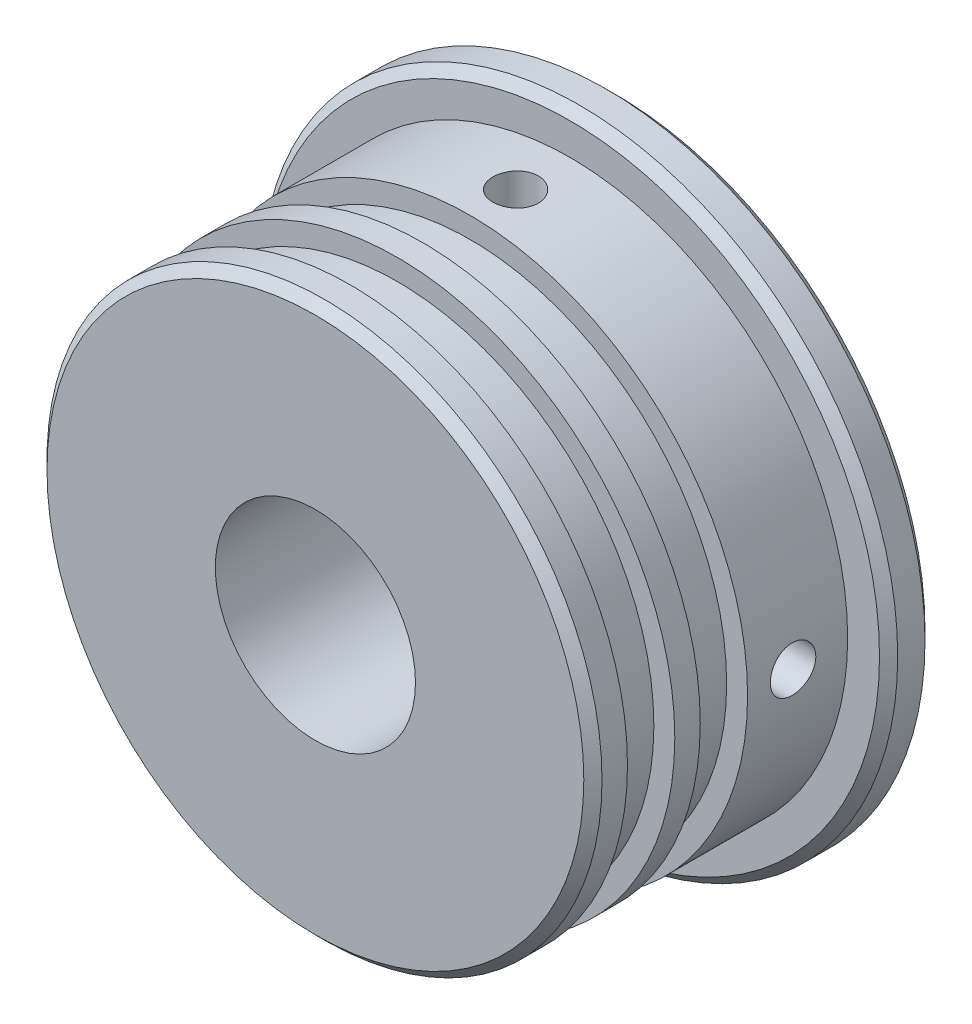
from build123d import *

# Parameters (mm, degrees)
SKETCH_1_R               = 17.5
SKETCH_1_R_2             = 5.5
EXTRUDE_1_DEPTH          = 2.5
EXTRUDE_START            = 14
SKETCH_1_3_R             = 15.25
SKETCH_1_3_R_2           = 5.5
EXTRUDE_2_DEPTH          = 14
CUT_EXTRUDE_START        = 8.1
SKETCH_1_4_R             = 15.25
SKETCH_1_4_R_2           = 14.1
CUT_EXTRUDE_1_DEPTH      = 2.6
CUT_EXTRUDE_START_2      = 12.1
SKETCH_1_5_R             = 15.25
SKETCH_1_5_R_2           = 14.1
CUT_EXTRUDE_2_DEPTH      = 2.6
CHAMFER_1_SIZE           = 0.5
SKETCH_2_R               = 6
CUT_EXTRUDE_3_DEPTH      = 2.5
CUT_EXTRUDE_START_3      = 10
SKETCH_3_R               = 1.25
CUT_EXTRUDE_4_DEPTH      = 10
PATTERN_CIRCULAR_1_COUNT = 4


with BuildPart() as part:
    # Эскиз1 → Бобышка-Вытянуть1 (new body)
    with BuildSketch(Plane.XY):
        Circle(SKETCH_1_R)
        Circle(SKETCH_1_R_2, mode=Mode.SUBTRACT)
    extrude(amount=-EXTRUDE_1_DEPTH)

    # Эскиз1<3> → Бобышка-Вытянуть2 (add)
    with BuildSketch(Plane.XY.offset(EXTRUDE_START)):
        Circle(SKETCH_1_3_R)
        Circle(SKETCH_1_3_R_2, mode=Mode.SUBTRACT)
    extrude(amount=-EXTRUDE_2_DEPTH)

    # Эскиз1<4> → Вырез-Вытянуть1 (cut)
    with BuildSketch(Plane.XY.offset(CUT_EXTRUDE_START)):
        Circle(SKETCH_1_4_R)
        Circle(SKETCH_1_4_R_2, mode=Mode.SUBTRACT)
    extrude(amount=-CUT_EXTRUDE_1_DEPTH, mode=Mode.SUBTRACT)

    # Эскиз1<5> → Вырез-Вытянуть2 (cut)
    with BuildSketch(Plane.XY.offset(CUT_EXTRUDE_START_2)):
        Circle(SKETCH_1_5_R)
        Circle(SKETCH_1_5_R_2, mode=Mode.SUBTRACT)
    extrude(amount=-CUT_EXTRUDE_2_DEPTH, mode=Mode.SUBTRACT)

    # Фаска1
    chamfer_1_edges = [part.edges().sort_by_distance(p)[0] for p in [
        (-15.25, 0, 14),
        (-17.5, 0, 0),
        (-17.5, 0, -2.5),
    ]]
    chamfer(chamfer_1_edges, length=CHAMFER_1_SIZE)

    # Эскиз2 → Вырез-Вытянуть3 (cut)
    with BuildSketch(Plane(origin=(0, 0, -2.5), x_dir=(-1, 0, 0), z_dir=(0, 0, -1))):
        Circle(SKETCH_2_R)
    extrude(amount=-CUT_EXTRUDE_3_DEPTH, mode=Mode.SUBTRACT)

    # Эскиз3 → Вырез-Вытянуть4 (cut)
    with BuildSketch(Plane(origin=(0, 0, 0), x_dir=(1, 0, 0), z_dir=(0, 1, 0)).offset(CUT_EXTRUDE_START_3)):
        with Locations((0, -3)):
            Circle(SKETCH_3_R)
    cut_extrude_4 = extrude(amount=CUT_EXTRUDE_4_DEPTH, mode=Mode.SUBTRACT)

    # Круговой массив1: Вырез-Вытянуть4 ×4 about axis
    pattern_circular_1_axis = Axis((0, 0, 0), (0, 0, -1))
    for i in range(1, PATTERN_CIRCULAR_1_COUNT):
        add(cut_extrude_4.rotate(pattern_circular_1_axis, i * 360 / PATTERN_CIRCULAR_1_COUNT), mode=Mode.SUBTRACT)


solid = part.part
